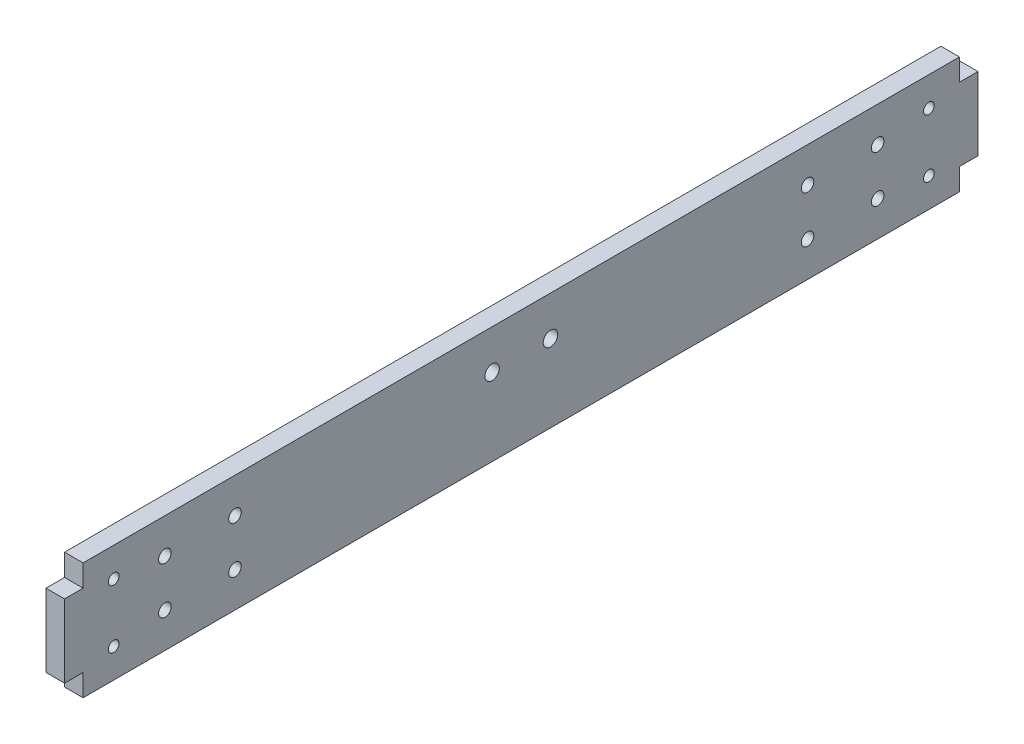
from build123d import *

# Parameters (mm, degrees)
SKETCH1_W              = 300
SKETCH1_H              = 40
BOSS_EXTRUDE1_DEPTH    = 6.35
SKETCH2_W              = 6.35
SKETCH2_H              = 25
BOSS_EXTRUDE2_DEPTH    = 6.35
F_10_CLEARANCE_HOLE1_D = 4.9784
F_8_CLEARANCE_HOLE1_D  = 4.3053
F_6_CLEARANCE_HOLE1_D  = 3.6576


with BuildPart() as part:
    # Sketch1 → Boss-Extrude1 (new body)
    with BuildSketch(Plane(origin=(0, 0, 0), x_dir=(0, 0, -1), z_dir=(1, 0, 0))):
        Rectangle(SKETCH1_W, SKETCH1_H)
    extrude(amount=BOSS_EXTRUDE1_DEPTH)

    # Sketch2 → Boss-Extrude2 (add)
    with BuildSketch(Plane(origin=(6.35, 0, 0), x_dir=(0, 0, -1), z_dir=(1, 0, 0))):
        with Locations((-153.175, 0)):
            Rectangle(SKETCH2_W, SKETCH2_H)
        with Locations((153.175, 0)):
            Rectangle(SKETCH2_W, SKETCH2_H)
    extrude(amount=-BOSS_EXTRUDE2_DEPTH)

    # #10 Clearance Hole1 (through all)
    with Locations(Plane(origin=(6.35, 0, 0), x_dir=(0, 0, -1), z_dir=(1, 0, 0))):
        with Locations((-10, 6.5), (10, 6.5)):
            Hole(F_10_CLEARANCE_HOLE1_D / 2)

    # #8 Clearance Hole1 (through all)
    with Locations(Plane(origin=(6.35, 0, 0), x_dir=(0, 0, -1), z_dir=(1, 0, 0))):
        with Locations((-122, 8), (-98, 8), (-98, -8), (-122, -8), (98, 8), (122, 8), (122, -8), (98, -8)):
            Hole(F_8_CLEARANCE_HOLE1_D / 2)

    # #6 Clearance Hole1 (through all)
    with Locations(Plane(origin=(6.35, 10, 139.5352), x_dir=(0, 0, 1), z_dir=(1, 0, 0))):
        with Locations((0, 0), (0, 20), (-279.0704, 0), (-279.0704, 20)):
            Hole(F_6_CLEARANCE_HOLE1_D / 2)


solid = part.part
